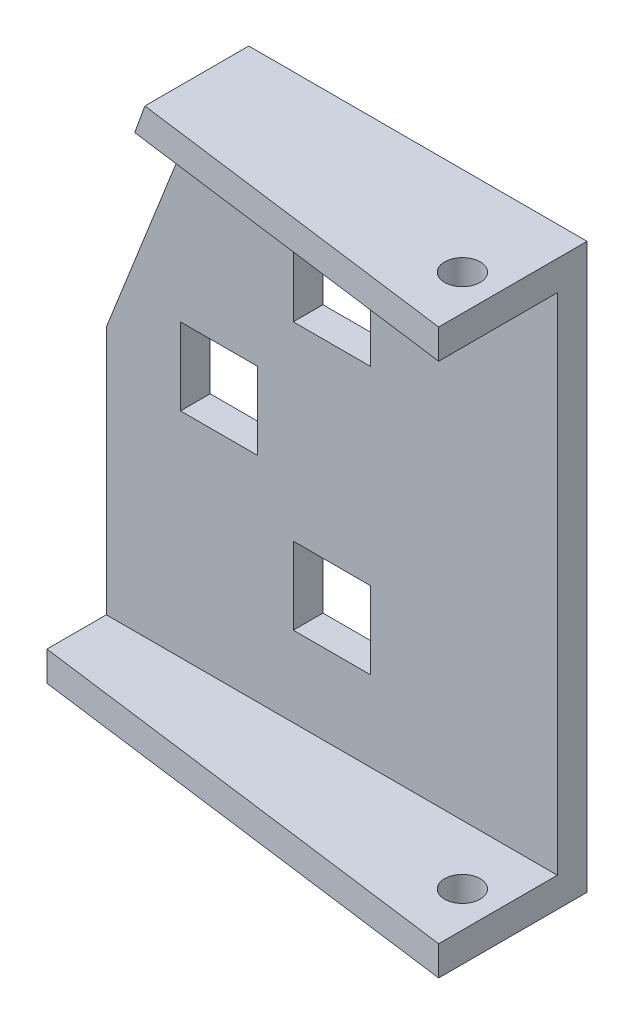
from build123d import *

# Parameters (mm, degrees)
BOSS_EXTRUDE1_DEPTH = 5
SKETCH2_W           = 13
SKETCH2_H           = 13
CUT_EXTRUDE1_DEPTH  = 119.11011811
SKETCH5_W           = 76
SKETCH5_H           = 5
BOSS_EXTRUDE3_DEPTH = 20
CUT_EXTRUDE2_DEPTH  = 121.623380818
SKETCH7_R           = 3
CUT_EXTRUDE4_DEPTH  = 121.623380818


with BuildPart() as part:
    # Sketch1 → Boss-Extrude1 (new body)
    with BuildSketch(Plane.XY):
        Polygon((-70, 0), (6, 0), (6, 95), (-51, 95), (-70, 47), align=None)
    extrude(amount=BOSS_EXTRUDE1_DEPTH)

    # Sketch2 → Cut-Extrude1 (cut, through all)
    with BuildSketch(Plane.XY.offset(5)):
        with Locations((-32, 70)):
            Rectangle(SKETCH2_W, SKETCH2_H)
        with Locations((-32, 25)):
            Rectangle(SKETCH2_W, SKETCH2_H)
        with Locations((-51, 47.5)):
            Rectangle(SKETCH2_W, SKETCH2_H)
    extrude(amount=-CUT_EXTRUDE1_DEPTH, mode=Mode.SUBTRACT)

    # Sketch5 → Boss-Extrude3 (add)
    with BuildSketch(Plane.XY.offset(5)):
        Polygon((-51, 95), (-52.979166667, 90), (6, 90), (6, 95), align=None)
        with Locations((-32, 2.5)):
            Rectangle(SKETCH5_W, SKETCH5_H)
    extrude(amount=BOSS_EXTRUDE3_DEPTH)

    # Sketch6 → Cut-Extrude2 (cut, through all)
    with BuildSketch(Plane.XZ):
        Polygon((6, 25), (-70, 15), (-70, 25), align=None)
    extrude(amount=-CUT_EXTRUDE2_DEPTH, mode=Mode.SUBTRACT)

    # Sketch7 → Cut-Extrude4 (cut, through all)
    with BuildSketch(Plane(origin=(0, 95, 0), x_dir=(1, 0, 0), z_dir=(0, 1, 0))):
        with Locations((0, -15)):
            Circle(SKETCH7_R)
    extrude(amount=-CUT_EXTRUDE4_DEPTH, mode=Mode.SUBTRACT)


solid = part.part
